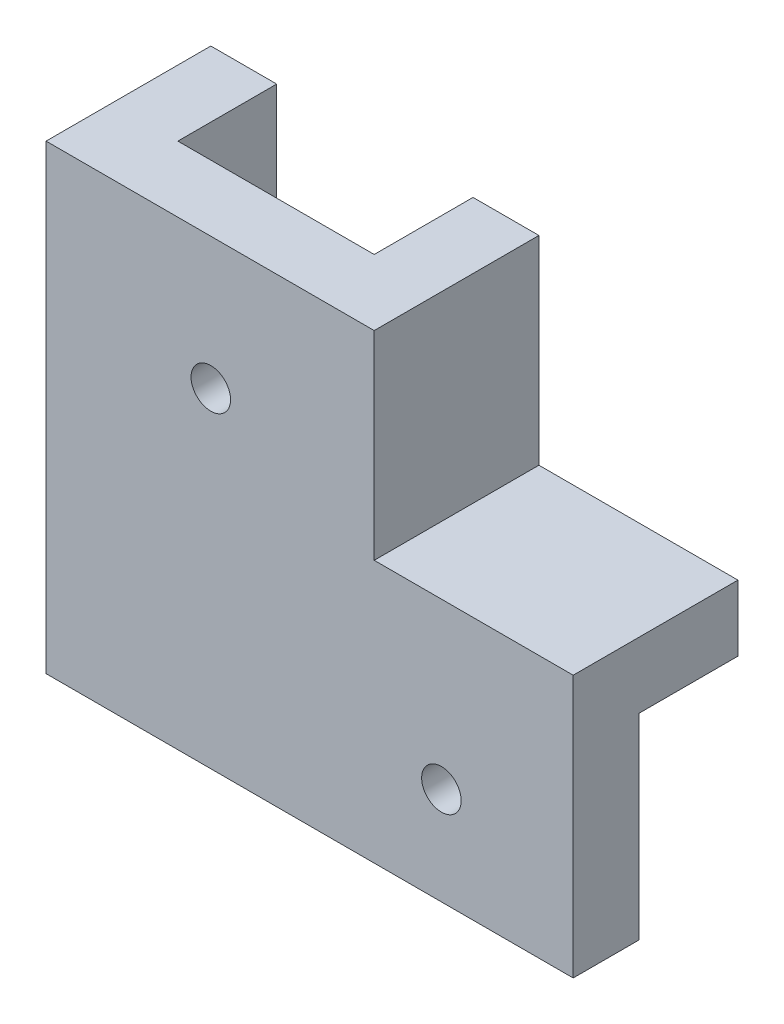
from build123d import *

# Parameters (mm, degrees)
BOSS_EXTRUDE1_DEPTH = 5
BOSS_EXTRUDE2_DEPTH = 7.5
SKETCH3_W           = 5
SKETCH3_H           = 35
BOSS_EXTRUDE3_DEPTH = 7.5
SKETCH4_W           = 5
SKETCH4_H           = 35
BOSS_EXTRUDE4_DEPTH = 5
BOSS_EXTRUDE5_DEPTH = 5
SKETCH7_R           = 1.5
CUT_EXTRUDE1_DEPTH  = 39.429767037


with BuildPart() as part:
    # Sketch1 → Boss-Extrude1 (new body)
    with BuildSketch(Plane.XY):
        Polygon((-7.529880478, -25.806772908), (27.470119522, -25.806772908), (27.470119522, -10.906772908), (7.370119522, -10.906772908), (7.370119522, 9.193227092), (-7.529880478, 9.193227092), align=None)
    extrude(amount=BOSS_EXTRUDE1_DEPTH)



with BuildPart() as body_2:
    # Sketch2 → Boss-Extrude2 (new body)
    with BuildSketch(Plane(origin=(0, 0, 0), x_dir=(-1, 0, 0), z_dir=(0, 0, -1))):
        Polygon((-7.370119522, 9.193227092), (-12.370119522, 9.193227092), (-12.370119522, -5.906772908), (-27.470119522, -5.906772908), (-27.470119522, -10.906772908), (-7.370119522, -10.906772908), align=None)
    extrude(amount=BOSS_EXTRUDE2_DEPTH)


with BuildPart() as body_3:
    # Sketch3 → Boss-Extrude3 (new body)
    with BuildSketch(Plane(origin=(0, 0, 0), x_dir=(-1, 0, 0), z_dir=(0, 0, -1))):
        with Locations((10.029880478, -8.306772908)):
            Rectangle(SKETCH3_W, SKETCH3_H)
    extrude(amount=BOSS_EXTRUDE3_DEPTH)


with BuildPart() as part_1:
    add(part.part)

    add(body_3.part)  # Boss-Extrude4 merges body 3
    # Sketch4 → Boss-Extrude4 (add)
    with BuildSketch(Plane.XY):
        with Locations((-10.029880478, -8.306772908)):
            Rectangle(SKETCH4_W, SKETCH4_H)
    extrude(amount=BOSS_EXTRUDE4_DEPTH)


    add(body_2.part)  # Boss-Extrude5 merges body 2
    # Sketch5 → Boss-Extrude5 (add)
    with BuildSketch(Plane.XY):
        Polygon((7.370119522, 9.193227092), (7.370119522, -10.906772908), (27.470119522, -10.906772908), (27.470119522, -5.906772908), (12.370119522, -5.906772908), (12.370119522, 9.193227092), align=None)
    extrude(amount=BOSS_EXTRUDE5_DEPTH)

    # Sketch7 → Cut-Extrude1 (cut, through all)
    with BuildSketch(Plane(origin=(0, 0, 0), x_dir=(-1, 0, 0), z_dir=(0, 0, -1))):
        with Locations((0.029880478, -0.806772908)):
            Circle(SKETCH7_R)
        with Locations((-17.470119522, -18.406772908)):
            Circle(SKETCH7_R)
    extrude(amount=-CUT_EXTRUDE1_DEPTH, mode=Mode.SUBTRACT)


solid = part_1.part
